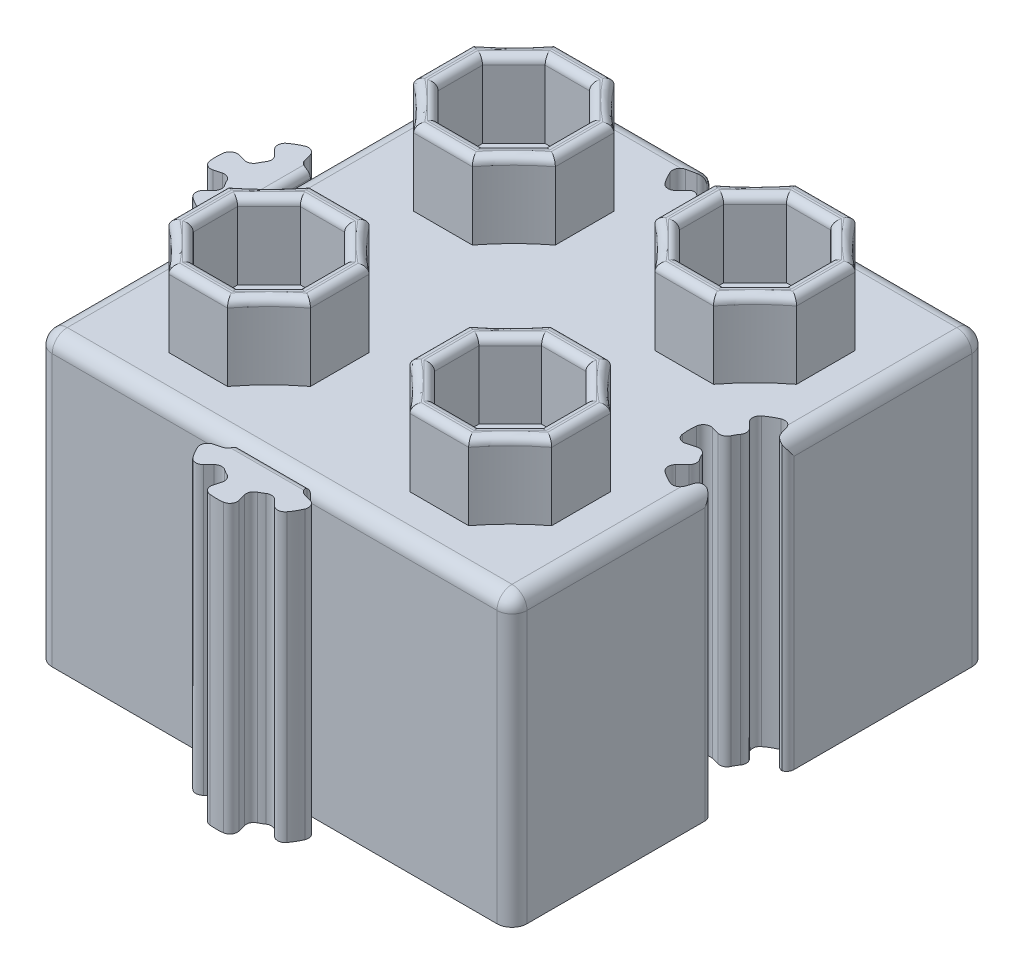
from build123d import *

# Parameters (mm, degrees)
SKETCH2_W                = 31.5
SKETCH2_H                = 31.5
BOSS_EXTRUDE1_DEPTH      = 19
CUT_EXTRUDE6_DEPTH       = 30.276697218
FILLET12_R               = 0.5
FILLET20_R               = 1
BOSS_EXTRUDE7_DEPTH      = 19
FILLET24_R               = 0.5
BOSS_EXTRUDE9_START      = -1
BOSS_EXTRUDE9_DEPTH      = 18
BOSS_EXTRUDE10_START     = -19
BOSS_EXTRUDE10_DEPTH     = 19
FILLET30_R               = 0.35
FILLET31_R               = 0.5
FILLET32_R               = 0.5
CUT_EXTRUDE13_DEPTH      = 2
CUT_EXTRUDE13_DEPTH_BACK = 1.5
BOSS_EXTRUDE11_DEPTH     = 5
FILLET33_R               = 0.5
CUT_EXTRUDE14_DEPTH      = 15
SKETCH18_W               = 1.2
SKETCH18_H               = 1.5
CUT_EXTRUDE15_DEPTH      = 0.025
CUT_EXTRUDE16_START      = -1.5
CUT_EXTRUDE16_DEPTH      = 1.5
FILLET34_R               = 0.5
FILLET35_START           = -1
FILLET35_DEPTH           = 16


with BuildPart() as part:
    # Sketch2 → Boss-Extrude1 (new body)
    with BuildSketch(Plane(origin=(0, 0, 0), x_dir=(1, 0, 0), z_dir=(0, 1, 0))):
        Rectangle(SKETCH2_W, SKETCH2_H)
    extrude(amount=BOSS_EXTRUDE1_DEPTH)

    # Sketch5 → Cut-Extrude6 (cut, through all)
    with BuildSketch(Plane(origin=(0, 19, 0), x_dir=(1, 0, 0), z_dir=(0, 1, 0))):
        with BuildLine():
            Line((-2.828427125, 12.921572875), (-1.767766953, 13.982233047))
            ThreePointArc((-1.767766953, 13.982233047), (-2.165063509, 14.5), (-2.414814566, 15.102952387))
            Line((-2.414814566, 15.102952387), (-3.863703305, 14.71472382))
            ThreePointArc((-3.863703305, 14.71472382), (-3.464101615, 13.75), (-2.828427125, 12.921572875))
        make_face()
        with BuildLine():
            Line((1.03527618, 11.886296695), (0.647047613, 13.335185434))
            ThreePointArc((0.647047613, 13.335185434), (0, 13.25), (-0.647047613, 13.335185434))
            Line((-0.647047613, 13.335185434), (-1.03527618, 11.886296695))
            ThreePointArc((-1.03527618, 11.886296695), (0, 11.75), (1.03527618, 11.886296695))
        make_face()
        with BuildLine():
            ThreePointArc((2.414814566, 15.102952387), (2.165063509, 14.5), (1.767766953, 13.982233047))
            Line((1.767766953, 13.982233047), (2.828427125, 12.921572875))
            ThreePointArc((2.828427125, 12.921572875), (3.464101615, 13.75), (3.863703305, 14.71472382))
            Line((3.863703305, 14.71472382), (2.414814566, 15.102952387))
        make_face()
        with BuildLine():
            ThreePointArc((-0.647047613, 13.335185434), (0, 13.25), (0.647047613, 13.335185434))
            ThreePointArc((0.647047613, 13.335185434), (1.25, 13.584936491), (1.767766953, 13.982233047))
            ThreePointArc((1.767766953, 13.982233047), (2.165063509, 14.5), (2.414814566, 15.102952387))
            ThreePointArc((2.414814566, 15.102952387), (2.478612153, 15.423684519), (2.5, 15.75))
            Line((2.5, 15.75), (0, 15.75))
            Line((0, 15.75), (-2.5, 15.75))
            ThreePointArc((-2.5, 15.75), (-2.478612153, 15.423684519), (-2.414814566, 15.102952387))
            ThreePointArc((-2.414814566, 15.102952387), (-2.165063509, 14.5), (-1.767766953, 13.982233047))
            ThreePointArc((-1.767766953, 13.982233047), (-1.25, 13.584936491), (-0.647047613, 13.335185434))
        make_face()
        with BuildLine():
            Line((15.75, -2.5), (15.75, 0))
            Line((15.75, 0), (15.75, 2.5))
            ThreePointArc((15.75, 2.5), (15.423684519, 2.478612153), (15.102952387, 2.414814566))
            ThreePointArc((15.102952387, 2.414814566), (14.5, 2.165063509), (13.982233047, 1.767766953))
            ThreePointArc((13.982233047, 1.767766953), (13.584936491, 1.25), (13.335185434, 0.647047613))
            ThreePointArc((13.335185434, 0.647047613), (13.25, 0), (13.335185434, -0.647047613))
            ThreePointArc((13.335185434, -0.647047613), (13.584936491, -1.25), (13.982233047, -1.767766953))
            ThreePointArc((13.982233047, -1.767766953), (14.5, -2.165063509), (15.102952387, -2.414814566))
            ThreePointArc((15.102952387, -2.414814566), (15.423684519, -2.478612153), (15.75, -2.5))
        make_face()
        with BuildLine():
            ThreePointArc((13.982233047, 1.767766953), (14.5, 2.165063509), (15.102952387, 2.414814566))
            Line((15.102952387, 2.414814566), (14.71472382, 3.863703305))
            ThreePointArc((14.71472382, 3.863703305), (13.75, 3.464101615), (12.921572875, 2.828427125))
            Line((12.921572875, 2.828427125), (13.982233047, 1.767766953))
        make_face()
        with BuildLine():
            Line((11.886296695, -1.03527618), (13.335185434, -0.647047613))
            ThreePointArc((13.335185434, -0.647047613), (13.25, 0), (13.335185434, 0.647047613))
            Line((13.335185434, 0.647047613), (11.886296695, 1.03527618))
            ThreePointArc((11.886296695, 1.03527618), (11.75, 0), (11.886296695, -1.03527618))
        make_face()
        with BuildLine():
            Line((14.71472382, -3.863703305), (15.102952387, -2.414814566))
            ThreePointArc((15.102952387, -2.414814566), (14.5, -2.165063509), (13.982233047, -1.767766953))
            Line((13.982233047, -1.767766953), (12.921572875, -2.828427125))
            ThreePointArc((12.921572875, -2.828427125), (13.75, -3.464101615), (14.71472382, -3.863703305))
        make_face()
    extrude(amount=-CUT_EXTRUDE6_DEPTH, mode=Mode.SUBTRACT)

    # Fillet12
    # the kernel refuses this fillet: 0.5 mm, written as the material it adds along each edge
    with BuildSketch(Plane(origin=(-2.828427125, 19, -12.921572875), x_dir=(0.7071067811865464, 0, -0.7071067811865488), z_dir=(0, -1, 0)), Plane(origin=(3.863703305, 19, -14.71472382), x_dir=(-0.9659258262890686, 0, -0.25881904510251896), z_dir=(0, -1, 0)), Plane(origin=(1.03527618, 19, -11.886296695), x_dir=(-0.25881904510252407, 0, -0.9659258262890674), z_dir=(0, -1, 0)), Plane(origin=(14.71472382, 19, 3.863703305), x_dir=(0.2588190451025213, 0, -0.9659258262890682), z_dir=(0, -1, 0)), Plane(origin=(11.886296695, 19, 1.03527618), x_dir=(0.9659258262890664, 0, -0.258819045102527), z_dir=(0, -1, 0)), Plane(origin=(12.921572875, 19, -2.828427125), x_dir=(0.7071067811865517, 0, 0.7071067811865434), z_dir=(0, -1, 0))) as fillet12_piece_1:
        with BuildLine():
            CenterArc((0.535898385, -0.5), FILLET12_R, 90, 98.213210702)
            ThreePointArc((0.041026726, -0.571428571), (0.010269865, -0.286449736), (0, 0))
            Line((0, 0), (0.535898385, 0))
        make_face()
    extrude(amount=19)
    with BuildSketch(Plane(origin=(-3.863703305, 19, -14.71472382), x_dir=(0.32732683535398166, 0, 0.9449111825230705), z_dir=(0, -1, 0)), Plane(origin=(2.828427125, 19, -12.921572875), x_dir=(0.6546536707079763, 0, -0.7559289460184553), z_dir=(0, -1, 0)), Plane(origin=(-1.03527618, 19, -11.886296695), x_dir=(0.9819805060619656, 0, 0.18898223650461393), z_dir=(0, -1, 0)), Plane(origin=(12.921572875, 19, 2.828427125), x_dir=(0.7559289460184622, 0, 0.6546536707079684), z_dir=(0, -1, 0)), Plane(origin=(11.886296695, 19, -1.03527618), x_dir=(-0.1889822365046017, 0, 0.9819805060619681), z_dir=(0, -1, 0)), Plane(origin=(14.71472382, 19, -3.863703305), x_dir=(-0.9449111825230665, 0, 0.327326835353993), z_dir=(0, -1, 0))) as fillet12_piece_2:
        with BuildLine():
            CenterArc((0.537093255, -0.498716267), FILLET12_R, 85.893394649, 98.213210702)
            Line((0.038376988, -0.534522484), (0, 0))
            ThreePointArc((0, 0), (0.286449736, 0.010269865), (0.572899472, 0))
        make_face()
    extrude(amount=19)
    # the kernel refuses this fillet: 0.5 mm, written as the material it takes off along each edge
    with BuildSketch(Plane(origin=(15.75, 20.145099729, -2.5), x_dir=(-0.996497189454961, 0, 0.08362626027967186), z_dir=(0, -1, 0)), Plane(origin=(15.102952387, 20.145099729, 2.414814566), x_dir=(0.9841864399500989, 0, 0.1771356864619615), z_dir=(0, -1, 0)), Plane(origin=(13.335185434, 20.145099729, 0.647047613), x_dir=(0.33868921558220527, 0, 0.9408983022879309), z_dir=(0, -1, 0)), Plane(origin=(13.982233047, 20.145099729, -1.767766953), x_dir=(-0.645497224367904, 0, 0.7637626158259723), z_dir=(0, -1, 0))) as fillet12_2_piece_1:
        with BuildLine():
            CenterArc((0.459944432, 0.498248595), FILLET12_R, 184.797034113, 80.405931773)
            Line((-0.038304163, 0.456435465), (0, 0))
            ThreePointArc((0, 0), (0.209065651, 0.008757026), (0.418131301, 0))
        make_face()
    extrude(amount=21.290199458, mode=Mode.SUBTRACT)
    with BuildSketch(Plane(origin=(15.75, 20.145099729, 2.5), x_dir=(0, 0, 1), z_dir=(0, -1, 0)), Plane(origin=(13.982233047, 20.145099729, 1.767766953), x_dir=(-0.7071067811865388, 0, 0.7071067811865562), z_dir=(0, -1, 0)), Plane(origin=(13.335185434, 20.145099729, -0.647047613), x_dir=(-0.9659258262890702, 0, -0.2588190451025135), z_dir=(0, -1, 0)), Plane(origin=(15.102952387, 20.145099729, -2.414814566), x_dir=(-0.25881904510252224, 0, -0.9659258262890679), z_dir=(0, -1, 0))) as fillet12_2_piece_2:
        with BuildLine():
            CenterArc((0.458039892, 0.5), FILLET12_R, 189.594068227, 80.405931773)
            ThreePointArc((-0.034966757, 0.416666667), (-0.008757026, 0.209065651), (0, 0))
            Line((0, 0), (0.458039892, 0))
        make_face()
    extrude(amount=21.290199458, mode=Mode.SUBTRACT)

    # Fillet20
    # the kernel refuses this fillet: 1 mm, written as the material it takes off along each edge
    with BuildSketch(Plane(origin=(14.75, 18, 14.75), x_dir=(0, 0, 1), z_dir=(1, 0, 0))) as fillet20_piece_1_section:
        Polygon((0, 0), (FILLET20_R * 1.02, 0), (FILLET20_R * 1.02, -FILLET20_R * 1.02), (0, -FILLET20_R * 1.02), align=None)
    fillet20_piece_1 = extrude(amount=FILLET20_R * 1.02, mode=Mode.PRIVATE)
    fillet20_piece_1 = fillet20_piece_1 - Plane(origin=(14.75, 18, 14.75), x_dir=(0, -0.7071067811865475, -0.7071067811865475), z_dir=(1, 0, 0)) * Sphere(FILLET20_R, mode=Mode.PRIVATE)
    add(fillet20_piece_1, mode=Mode.SUBTRACT)
    with BuildSketch(Plane(origin=(14.75, 18, -14.75), x_dir=(0, 0, -1), z_dir=(0, 1, 0))) as fillet20_piece_2_section:
        Polygon((0, 0), (FILLET20_R * 1.02, 0), (FILLET20_R * 1.02, -FILLET20_R * 1.02), (0, -FILLET20_R * 1.02), align=None)
    fillet20_piece_2 = extrude(amount=FILLET20_R * 1.02, mode=Mode.PRIVATE)
    fillet20_piece_2 = fillet20_piece_2 - Plane(origin=(14.75, 18, -14.75), x_dir=(-0.7071067811865475, 0, 0.7071067811865477), z_dir=(0, 1, 0)) * Sphere(FILLET20_R, mode=Mode.PRIVATE)
    add(fillet20_piece_2, mode=Mode.SUBTRACT)
    with BuildSketch(Plane(origin=(-14.75, 18, -14.75), x_dir=(-1, 0, 0), z_dir=(0, 1, 0))) as fillet20_piece_3_section:
        Polygon((0, 0), (FILLET20_R * 1.02, 0), (FILLET20_R * 1.02, -FILLET20_R * 1.02), (0, -FILLET20_R * 1.02), align=None)
    fillet20_piece_3 = extrude(amount=FILLET20_R * 1.02, mode=Mode.PRIVATE)
    fillet20_piece_3 = fillet20_piece_3 - Plane(origin=(-14.75, 18, -14.75), x_dir=(0.7071067811865476, 0, 0.7071067811865474), z_dir=(0, 1, 0)) * Sphere(FILLET20_R, mode=Mode.PRIVATE)
    add(fillet20_piece_3, mode=Mode.SUBTRACT)
    with BuildSketch(Plane(origin=(-14.75, 18, 14.75), x_dir=(-1, 0, 0), z_dir=(0, 0, 1))) as fillet20_piece_4_section:
        Polygon((0, 0), (FILLET20_R * 1.02, 0), (FILLET20_R * 1.02, -FILLET20_R * 1.02), (0, -FILLET20_R * 1.02), align=None)
    fillet20_piece_4 = extrude(amount=FILLET20_R * 1.02, mode=Mode.PRIVATE)
    fillet20_piece_4 = fillet20_piece_4 - Plane(origin=(-14.75, 18, 14.75), x_dir=(0.7071067811865475, -0.7071067811865475, 0), z_dir=(0, 0, 1)) * Sphere(FILLET20_R, mode=Mode.PRIVATE)
    add(fillet20_piece_4, mode=Mode.SUBTRACT)
    with BuildSketch(Plane(origin=(15.75, -2.5, 15.75), x_dir=(0, 0, -1), z_dir=(0, 1, 0)), Plane(origin=(15.75, -2.5, -15.75), x_dir=(-1, 0, 0), z_dir=(0, 1, 0)), Plane(origin=(-15.75, -2.5, -15.75), x_dir=(0, 0, 1), z_dir=(0, 1, 0)), Plane(origin=(-15.75, -2.5, 15.75), x_dir=(1, 0, 0), z_dir=(0, 1, 0))) as fillet20_piece_5:
        with BuildLine():
            CenterArc((FILLET20_R, FILLET20_R), FILLET20_R, 180, 90)
            Line((0, FILLET20_R), (0, 0))
            Line((0, 0), (FILLET20_R, 0))
        make_face()
    extrude(amount=20.5, mode=Mode.SUBTRACT)
    with BuildSketch(Plane(origin=(-14.75, 19, -15.75), x_dir=(0, 0, 1), z_dir=(1, 0, 0)), Plane(origin=(0, 19, -15.75), x_dir=(0, 0, 1), z_dir=(1, 0, 0))) as fillet20_piece_6:
        with BuildLine():
            CenterArc((FILLET20_R, FILLET20_R), FILLET20_R, 180, 90)
            Line((0, FILLET20_R), (0, 0))
            Line((0, 0), (FILLET20_R, 0))
        make_face()
    extrude(amount=14.75, mode=Mode.SUBTRACT)
    with BuildSketch(Plane(origin=(15.75, 19, -14.75), x_dir=(-1, 0, 0), z_dir=(0, 0, 1)), Plane(origin=(15.75, 19, 0.458039892), x_dir=(-1, 0, 0), z_dir=(0, 0, 1))) as fillet20_piece_7:
        with BuildLine():
            CenterArc((FILLET20_R, FILLET20_R), FILLET20_R, 180, 90)
            Line((0, FILLET20_R), (0, 0))
            Line((0, 0), (FILLET20_R, 0))
        make_face()
    extrude(amount=14.291960108, mode=Mode.SUBTRACT)
    with BuildSketch(Plane(origin=(14.75, 19, 15.75), x_dir=(0, 0, -1), z_dir=(-1, 0, 0)), Plane(origin=(-15.75, 19, 14.75), x_dir=(1, 0, 0), z_dir=(0, 0, -1))) as fillet20_piece_8:
        with BuildLine():
            CenterArc((FILLET20_R, FILLET20_R), FILLET20_R, 180, 90)
            Line((0, FILLET20_R), (0, 0))
            Line((0, 0), (FILLET20_R, 0))
        make_face()
    extrude(amount=29.5, mode=Mode.SUBTRACT)

    # Sketch6 → Boss-Extrude7 (add, through all)
    with BuildSketch(Plane(origin=(0, 19, 0), x_dir=(1, 0, 0), z_dir=(0, 1, 0))):
        with BuildLine():
            ThreePointArc((-2.375, -15.75), (-2.354681546, -16.059999707), (-2.294073837, -16.364695232))
            Line((-2.294073837, -16.364695232), (-3.742962577, -16.7529238))
            ThreePointArc((-3.742962577, -16.7529238), (-3.35584844, -17.6875), (-2.740038777, -18.490038777))
            Line((-2.740038777, -18.490038777), (-1.679378605, -17.429378605))
            ThreePointArc((-1.679378605, -17.429378605), (-1.189926656, -17.805407393), (-0.620108527, -18.0426165))
            Line((-0.620108527, -18.0426165), (-1.011756018, -19.490584815))
            ThreePointArc((-1.011756018, -19.490584815), (0, -19.625), (1.011756018, -19.490584815))
            Line((1.011756018, -19.490584815), (0.620108527, -18.0426165))
            ThreePointArc((0.620108527, -18.0426165), (1.189926656, -17.805407393), (1.679378605, -17.429378605))
            Line((1.679378605, -17.429378605), (2.740038777, -18.490038777))
            ThreePointArc((2.740038777, -18.490038777), (3.35584844, -17.6875), (3.742962577, -16.7529238))
            Line((3.742962577, -16.7529238), (2.294073837, -16.364695232))
            ThreePointArc((2.294073837, -16.364695232), (2.354681546, -16.059999707), (2.375, -15.75))
            Line((2.375, -15.75), (-2.375, -15.75))
        make_face()
        with BuildLine():
            Line((-15.75, -2.375), (-15.75, 2.375))
            ThreePointArc((-15.75, 2.375), (-16.059999707, 2.354681546), (-16.364695232, 2.294073837))
            Line((-16.364695232, 2.294073837), (-16.7529238, 3.742962577))
            ThreePointArc((-16.7529238, 3.742962577), (-17.6875, 3.35584844), (-18.490038777, 2.740038777))
            Line((-18.490038777, 2.740038777), (-17.429378605, 1.679378605))
            ThreePointArc((-17.429378605, 1.679378605), (-17.806810334, 1.1875), (-18.044073837, 0.614695232))
            Line((-18.044073837, 0.614695232), (-19.492962577, 1.0029238))
            ThreePointArc((-19.492962577, 1.0029238), (-19.625, 0), (-19.492962577, -1.0029238))
            Line((-19.492962577, -1.0029238), (-18.044073837, -0.614695232))
            ThreePointArc((-18.044073837, -0.614695232), (-17.806810334, -1.1875), (-17.429378605, -1.679378605))
            Line((-17.429378605, -1.679378605), (-18.490038777, -2.740038777))
            ThreePointArc((-18.490038777, -2.740038777), (-17.6875, -3.35584844), (-16.7529238, -3.742962577))
            Line((-16.7529238, -3.742962577), (-16.364695232, -2.294073837))
            ThreePointArc((-16.364695232, -2.294073837), (-16.059999707, -2.354681546), (-15.75, -2.375))
        make_face()
    extrude(amount=-BOSS_EXTRUDE7_DEPTH)

    # Fillet24
    fillet24_edges = [part.edges().sort_by_distance(p)[0] for p in [
        (-16.364695232, 9.5, 2.294073837),
        (-16.7529238, 9.5, 3.742962577),
        (-18.490038777, 9.5, 2.740038777),
        (-17.429378605, 9.5, 1.679378605),
        (-18.044073837, 9.5, 0.614695232),
        (-19.492962577, 9.5, 1.0029238),
        (-19.492962577, 9.5, -1.0029238),
        (-18.044073837, 9.5, -0.614695232),
        (-17.429378605, 9.5, -1.679378605),
        (-18.490038777, 9.5, -2.740038777),
        (-16.7529238, 9.5, -3.742962577),
        (-16.364695232, 9.5, -2.294073837),
        (0.620108527, 9.5, 18.0426165),
        (1.011756018, 9.5, 19.490584815),
        (-1.011756018, 9.5, 19.490584815),
        (-0.620108527, 9.5, 18.0426165),
        (-1.679378605, 9.5, 17.429378605),
        (-2.740038777, 9.5, 18.490038777),
        (-3.742962577, 9.5, 16.7529238),
        (-2.294073837, 9.5, 16.364695232),
        (2.294073837, 9.5, 16.364695232),
        (3.742962577, 9.5, 16.7529238),
        (2.740038777, 9.5, 18.490038777),
        (1.679378605, 9.5, 17.429378605),
    ]]
    fillet(fillet24_edges, radius=FILLET24_R)

    # Sketch10 → Boss-Extrude9 (add, through all)
    with BuildSketch(Plane(origin=(0, 19, 0), x_dir=(1, 0, 0), z_dir=(0, 1, 0)).offset(BOSS_EXTRUDE9_START)):
        with BuildLine():
            Line((15.75, 4.4), (15.75, 4))
            ThreePointArc((15.75, 4), (11.75, 0), (15.75, -4))
            Line((15.75, -4), (15.75, -4.4))
            ThreePointArc((15.75, -4.4), (11.35, 0), (15.75, 4.4))
        make_face()
        with BuildLine():
            Line((-4.4, 15.75), (-4, 15.75))
            ThreePointArc((-4, 15.75), (0, 11.75), (4, 15.75))
            Line((4, 15.75), (4.4, 15.75))
            ThreePointArc((4.4, 15.75), (0, 11.35), (-4.4, 15.75))
        make_face()
    extrude(amount=-BOSS_EXTRUDE9_DEPTH)

    # Boss-Extrude10: read off the stored shape, not the designer's step
    # Boss-Extrude10 outline → Boss-Extrude10 (add)
    with BuildSketch(Plane(origin=(0, 19, 0), x_dir=(1, 0, 0), z_dir=(0, 1, 0)).offset(BOSS_EXTRUDE10_START)):
        with BuildLine():
            Line((13.658349934, -2.091650066), (14.070621395, -1.679378605))
            ThreePointArc((14.070621395, -1.679378605), (13.693189666, -1.1875), (13.455926163, -0.614695232))
            Line((13.455926163, -0.614695232), (12.892752874, -0.76559706))
            ThreePointArc((12.892752874, -0.76559706), (13.235075461, -0.796157468), (13.476801997, -1.040466644))
            ThreePointArc((13.476801997, -1.040466644), (13.584936491, -1.25), (13.712330453, -1.448413896))
            ThreePointArc((13.712330453, -1.448413896), (13.803045138, -1.779909805), (13.658349934, -2.091650066))
        make_face()
    extrude(amount=BOSS_EXTRUDE10_DEPTH)

    # Fillet30
    fillet30_edges = [part.edges().sort_by_distance(p)[0] for p in [
        (2.493564071, 18.571318411, -15.570728498),
        (-2.493564071, 18.571318411, -15.570728498),
        (2.5, 9, -15.75),
        (2.414814566, 9.467820642, -15.102952387),
        (-2.414814566, 9.467820642, -15.102952387),
        (-2.5, 9, -15.75),
        (-1.767766953, 9.5, -13.982233047),
        (-0.647047613, 9.5, -13.335185434),
        (0.647047613, 9.5, -13.335185434),
    ]]
    fillet(fillet30_edges, radius=FILLET30_R)

    # Fillet31
    fillet31_edges = [part.edges().sort_by_distance(p)[0] for p in [
        (0, 19, 15.75),
        (-15.75, 19, 0),
    ]]
    fillet(fillet31_edges, radius=FILLET31_R)

    # Fillet32
    fillet32_edges = [part.edges().sort_by_distance(p)[0] for p in [
        (13.455926163, 9.5, 0.614695232),
        (14.070621395, 9.5, 1.679378605),
    ]]
    fillet(fillet32_edges, radius=FILLET32_R)

    # Sketch16 → Cut-Extrude13 (cut, two sides: drawn at the far end of the back side and taken through both)
    with BuildSketch(Plane.XZ.offset(-CUT_EXTRUDE13_DEPTH_BACK)):
        with BuildLine():
            Line((-14.3, 14.3), (-8.175, 14.3))
            Line((-8.175, 14.3), (-8.175, 12.6))
            ThreePointArc((-8.175, 12.6), (-8.145710678, 12.529289322), (-8.075, 12.5))
            Line((-8.075, 12.5), (-6.825, 12.5))
            ThreePointArc((-6.825, 12.5), (-6.754289322, 12.529289322), (-6.725, 12.6))
            Line((-6.725, 12.6), (-6.725, 14.3))
            Line((-6.725, 14.3), (6.721665956, 14.3))
            Line((6.721665956, 14.3), (6.721665956, 12.6))
            ThreePointArc((6.721665956, 12.6), (6.750955278, 12.529289322), (6.821665956, 12.5))
            Line((6.821665956, 12.5), (8.071665956, 12.5))
            ThreePointArc((8.071665956, 12.5), (8.142376634, 12.529289322), (8.171665956, 12.6))
            Line((8.171665956, 12.6), (8.171665956, 14.3))
            Line((8.171665956, 14.3), (14.3, 14.3))
            Line((14.3, 14.3), (14.3, 8.175))
            Line((14.3, 8.175), (12.6, 8.175))
            ThreePointArc((12.6, 8.175), (12.529289322, 8.145710678), (12.5, 8.075))
            Line((12.5, 8.075), (12.5, 6.825))
            ThreePointArc((12.5, 6.825), (12.529289322, 6.754289322), (12.6, 6.725))
            Line((12.6, 6.725), (14.3, 6.725))
            Line((14.3, 6.725), (14.3, 4.623310502))
            ThreePointArc((14.3, 4.623310502), (11.956404012, 3.135991924), (10.82799643, 0.6))
            ThreePointArc((10.82799643, 0.6), (10.782740417, 0), (10.82799643, -0.6))
            ThreePointArc((10.82799643, -0.6), (11.956404012, -3.135991924), (14.3, -4.623310502))
            Line((14.3, -4.623310502), (14.3, -6.725))
            Line((14.3, -6.725), (12.6, -6.725))
            ThreePointArc((12.6, -6.725), (12.529289322, -6.754289322), (12.5, -6.825))
            Line((12.5, -6.825), (12.5, -8.075))
            ThreePointArc((12.5, -8.075), (12.529289322, -8.145710678), (12.6, -8.175))
            Line((12.6, -8.175), (14.3, -8.175))
            Line((14.3, -8.175), (14.3, -14.3))
            Line((14.3, -14.3), (8.35038088, -14.3))
            Line((8.35038088, -14.3), (8.171665956, -14.3))
            Line((8.171665956, -14.3), (8.171665956, -12.6))
            ThreePointArc((8.171665956, -12.6), (8.142376634, -12.529289322), (8.071665956, -12.5))
            Line((8.071665956, -12.5), (6.821665956, -12.5))
            ThreePointArc((6.821665956, -12.5), (6.750955278, -12.529289322), (6.721665956, -12.6))
            Line((6.721665956, -12.6), (6.721665956, -14.3))
            Line((6.721665956, -14.3), (4.623310502, -14.3))
            Line((4.623310502, -14.3), (4.575751304, -14.3))
            ThreePointArc((4.575751304, -14.3), (3.072656017, -12.062346952), (0.600502286, -10.987710949))
            ThreePointArc((0.600502286, -10.987710949), (-0.001645996, -10.942336934), (-0.603763067, -10.988123252))
            ThreePointArc((-0.603763067, -10.988123252), (-3.073918375, -12.063399151), (-4.575751304, -14.3))
            Line((-4.575751304, -14.3), (-4.623310502, -14.3))
            Line((-4.623310502, -14.3), (-6.725, -14.3))
            Line((-6.725, -14.3), (-6.725, -12.6))
            ThreePointArc((-6.725, -12.6), (-6.754289322, -12.529289322), (-6.825, -12.5))
            Line((-6.825, -12.5), (-8.075, -12.5))
            ThreePointArc((-8.075, -12.5), (-8.145710678, -12.529289322), (-8.175, -12.6))
            Line((-8.175, -12.6), (-8.175, -14.3))
            Line((-8.175, -14.3), (-14.3, -14.3))
            Line((-14.3, -14.3), (-14.3, -8.175))
            Line((-14.3, -8.175), (-12.6, -8.175))
            ThreePointArc((-12.6, -8.175), (-12.529289322, -8.145710678), (-12.5, -8.075))
            Line((-12.5, -8.075), (-12.5, -6.825))
            ThreePointArc((-12.5, -6.825), (-12.529289322, -6.754289322), (-12.6, -6.725))
            Line((-12.6, -6.725), (-14.3, -6.725))
            Line((-14.3, -6.725), (-14.3, 6.725))
            Line((-14.3, 6.725), (-12.6, 6.725))
            ThreePointArc((-12.6, 6.725), (-12.529289322, 6.754289322), (-12.5, 6.825))
            Line((-12.5, 6.825), (-12.5, 8.075))
            ThreePointArc((-12.5, 8.075), (-12.529289322, 8.145710678), (-12.6, 8.175))
            Line((-12.6, 8.175), (-14.3, 8.175))
            Line((-14.3, 8.175), (-14.3, 14.3))
        make_face()
    extrude(amount=CUT_EXTRUDE13_DEPTH + CUT_EXTRUDE13_DEPTH_BACK, mode=Mode.SUBTRACT)

    # Sketch3 → Boss-Extrude11 (add)
    # profile 1 of 4: a face of its own
    with BuildSketch(Plane(origin=(0, 19, 0), x_dir=(1, 0, 0), z_dir=(0, 1, 0))):
        with BuildLine():
            ThreePointArc((-9.946803743, 3.421093296), (-11.233690264, 4.887403031), (-12.7, 6.174289552))
            Line((-12.7, 6.174289552), (-12.7, 10.067897039))
            ThreePointArc((-12.7, 10.067897039), (-11.233690264, 11.35478356), (-9.946803743, 12.821093296))
            Line((-9.946803743, 12.821093296), (-6.053196257, 12.821093296))
            ThreePointArc((-6.053196257, 12.821093296), (-4.766309736, 11.35478356), (-3.3, 10.067897039))
            Line((-3.3, 10.067897039), (-3.3, 6.174289552))
            ThreePointArc((-3.3, 6.174289552), (-4.766309736, 4.887403031), (-6.053196257, 3.421093296))
            Line((-6.053196257, 3.421093296), (-9.946803743, 3.421093296))
        make_face()
        Polygon((-9.470458146, 4.571093296), (-6.529541854, 4.571093296), (-4.45, 6.650635149), (-4.45, 9.591551442), (-6.529541854, 11.671093296), (-9.470458146, 11.671093296), (-11.55, 9.591551442), (-11.55, 6.650635149), align=None, mode=Mode.SUBTRACT)
    # profile 2 of 4: a face of its own
    with BuildSketch(Plane(origin=(0, 19, 0), x_dir=(1, 0, 0), z_dir=(0, 1, 0))):
        with BuildLine():
            Line((12.7, 10.067897039), (12.7, 6.174289552))
            ThreePointArc((12.7, 6.174289552), (11.233690264, 4.887403031), (9.946803743, 3.421093296))
            Line((9.946803743, 3.421093296), (6.053196257, 3.421093296))
            ThreePointArc((6.053196257, 3.421093296), (4.766309736, 4.887403031), (3.3, 6.174289552))
            Line((3.3, 6.174289552), (3.3, 10.067897039))
            ThreePointArc((3.3, 10.067897039), (4.766309736, 11.35478356), (6.053196257, 12.821093296))
            Line((6.053196257, 12.821093296), (9.946803743, 12.821093296))
            ThreePointArc((9.946803743, 12.821093296), (11.233690264, 11.35478356), (12.7, 10.067897039))
        make_face()
        Polygon((9.470458146, 4.571093296), (6.529541854, 4.571093296), (4.45, 6.650635149), (4.45, 9.591551442), (6.529541854, 11.671093296), (9.470458146, 11.671093296), (11.55, 9.591551442), (11.55, 6.650635149), align=None, mode=Mode.SUBTRACT)
    # profile 3 of 4: a face of its own
    with BuildSketch(Plane(origin=(0, 19, 0), x_dir=(1, 0, 0), z_dir=(0, 1, 0))):
        with BuildLine():
            ThreePointArc((9.946803743, -3.421093296), (11.233690264, -4.887403031), (12.7, -6.174289552))
            Line((12.7, -6.174289552), (12.7, -10.067897039))
            ThreePointArc((12.7, -10.067897039), (11.233690264, -11.35478356), (9.946803743, -12.821093296))
            Line((9.946803743, -12.821093296), (6.053196257, -12.821093296))
            ThreePointArc((6.053196257, -12.821093296), (4.766309736, -11.35478356), (3.3, -10.067897039))
            Line((3.3, -10.067897039), (3.3, -6.174289552))
            ThreePointArc((3.3, -6.174289552), (4.766309736, -4.887403031), (6.053196257, -3.421093296))
            Line((6.053196257, -3.421093296), (9.946803743, -3.421093296))
        make_face()
        Polygon((9.470458146, -4.571093296), (6.529541854, -4.571093296), (4.45, -6.650635149), (4.45, -9.591551442), (6.529541854, -11.671093296), (9.470458146, -11.671093296), (11.55, -9.591551442), (11.55, -6.650635149), align=None, mode=Mode.SUBTRACT)
    # profile 4 of 4: a face of its own
    with BuildSketch(Plane(origin=(0, 19, 0), x_dir=(1, 0, 0), z_dir=(0, 1, 0))):
        with BuildLine():
            Line((-12.7, -10.067897039), (-12.7, -6.174289552))
            ThreePointArc((-12.7, -6.174289552), (-11.233690264, -4.887403031), (-9.946803743, -3.421093296))
            Line((-9.946803743, -3.421093296), (-6.053196257, -3.421093296))
            ThreePointArc((-6.053196257, -3.421093296), (-4.766309736, -4.887403031), (-3.3, -6.174289552))
            Line((-3.3, -6.174289552), (-3.3, -10.067897039))
            ThreePointArc((-3.3, -10.067897039), (-4.766309736, -11.35478356), (-6.053196257, -12.821093296))
            Line((-6.053196257, -12.821093296), (-9.946803743, -12.821093296))
            ThreePointArc((-9.946803743, -12.821093296), (-11.233690264, -11.35478356), (-12.7, -10.067897039))
        make_face()
        Polygon((-9.470458146, -4.571093296), (-6.529541854, -4.571093296), (-4.45, -6.650635149), (-4.45, -9.591551442), (-6.529541854, -11.671093296), (-9.470458146, -11.671093296), (-11.55, -9.591551442), (-11.55, -6.650635149), align=None, mode=Mode.SUBTRACT)
    extrude(amount=BOSS_EXTRUDE11_DEPTH)

    # Fillet33
    fillet33_edges = [part.edges().sort_by_distance(p)[0] for p in [
        (-8, 24, -4.571093296),
        (-10.510229073, 24, -5.610864222),
        (-11.55, 24, -8.121093296),
        (-10.510229073, 24, -10.631322369),
        (-8, 24, -11.671093296),
        (-5.489770927, 24, -10.631322369),
        (-4.45, 24, -8.121093296),
        (-11.233690264, 24, -4.887403031),
        (-4.766309736, 24, -11.35478356),
        (-11.233690264, 24, -11.35478356),
        (-5.489770927, 24, -5.610864222),
        (-8, 24, -3.421093296),
        (-4.766309736, 24, -4.887403031),
        (-3.3, 24, -8.121093296),
        (-8, 24, -12.821093296),
        (-12.7, 24, -8.121093296),
        (12.7, 24, -8.121093296),
        (8, 24, -12.821093296),
        (3.3, 24, -8.121093296),
        (4.766309736, 24, -4.887403031),
        (8, 24, -3.421093296),
        (8, 24, -4.571093296),
        (5.489770927, 24, -5.610864222),
        (4.45, 24, -8.121093296),
        (5.489770927, 24, -10.631322369),
        (8, 24, -11.671093296),
        (10.510229073, 24, -10.631322369),
        (11.55, 24, -8.121093296),
        (10.510229073, 24, -5.610864222),
        (11.233690264, 24, -11.35478356),
        (4.766309736, 24, -11.35478356),
        (11.233690264, 24, -4.887403031),
        (8, 24, 4.571093296),
        (10.510229073, 24, 5.610864222),
        (11.55, 24, 8.121093296),
        (10.510229073, 24, 10.631322369),
        (8, 24, 11.671093296),
        (5.489770927, 24, 10.631322369),
        (4.45, 24, 8.121093296),
        (11.233690264, 24, 4.887403031),
        (4.766309736, 24, 11.35478356),
        (11.233690264, 24, 11.35478356),
        (5.489770927, 24, 5.610864222),
        (8, 24, 3.421093296),
        (4.766309736, 24, 4.887403031),
        (3.3, 24, 8.121093296),
        (8, 24, 12.821093296),
        (12.7, 24, 8.121093296),
        (-12.7, 24, 8.121093296),
        (-8, 24, 12.821093296),
        (-3.3, 24, 8.121093296),
        (-4.766309736, 24, 4.887403031),
        (-8, 24, 3.421093296),
        (-8, 24, 4.571093296),
        (-5.489770927, 24, 5.610864222),
        (-4.45, 24, 8.121093296),
        (-5.489770927, 24, 10.631322369),
        (-8, 24, 11.671093296),
        (-10.510229073, 24, 10.631322369),
        (-11.55, 24, 8.121093296),
        (-10.510229073, 24, 5.610864222),
        (-11.233690264, 24, 11.35478356),
        (-4.766309736, 24, 11.35478356),
        (-11.233690264, 24, 4.887403031),
    ]]
    fillet(fillet33_edges, radius=FILLET33_R)

    # Sketch7 → Cut-Extrude14 (cut)
    with BuildSketch(Plane.XZ):
        with BuildLine():
            ThreePointArc((-4.259988263, -14.3), (-2.859722023, -12.275523068), (-0.603763067, -11.290687255))
            Line((-0.603763067, -11.290687255), (-0.603763067, -4.963413156))
            ThreePointArc((-0.603763067, -4.963413156), (-1.845028292, -4.647135742), (-2.965202778, -4.025862949))
            Line((-2.965202778, -4.025862949), (-3.959797975, -5.020458146))
            Line((-3.959797975, -5.020458146), (-5.020458146, -3.959797975))
            Line((-5.020458146, -3.959797975), (-4.027923069, -2.962403712))
            ThreePointArc((-4.027923069, -2.962403712), (-4.64847513, -1.841651151), (-4.963869458, -0.6))
            Line((-4.963869458, -0.6), (-14.325, -0.6))
            Line((-14.325, -0.6), (-14.325, -6.725))
            Line((-14.325, -6.725), (-12.675, -6.725))
            Line((-12.675, -6.725), (-12.675, -7.3))
            Line((-12.675, -7.3), (-14.325, -7.3))
            Line((-14.325, -7.3), (-14.325, -14.3))
            Line((-14.325, -14.3), (-7.325, -14.3))
            Line((-7.325, -14.3), (-7.325, -12.65))
            Line((-7.325, -12.65), (-6.725, -12.65))
            Line((-6.725, -12.65), (-6.725, -14.3))
            Line((-6.725, -14.3), (-4.259988263, -14.3))
        make_face()
        with BuildLine():
            ThreePointArc((14.3, -4.259988263), (12.274316834, -2.858255854), (11.290179376, -0.6))
            Line((11.290179376, -0.6), (4.963869458, -0.6))
            ThreePointArc((4.963869458, -0.6), (4.64847513, -1.841651151), (4.027923069, -2.962403712))
            Line((4.027923069, -2.962403712), (5.020458146, -3.959797975))
            Line((5.020458146, -3.959797975), (3.959797975, -5.020458146))
            Line((3.959797975, -5.020458146), (2.965202778, -4.025862949))
            ThreePointArc((2.965202778, -4.025862949), (1.843266601, -4.64783479), (0.6, -4.963869458))
            Line((0.6, -4.963869458), (0.6, -11.290179376))
            ThreePointArc((0.6, -11.290179376), (2.86843208, -12.282710367), (4.268415983, -14.325))
            Line((4.268415983, -14.325), (6.7, -14.325))
            Line((6.7, -14.325), (6.7, -12.525))
            Line((6.7, -12.525), (7.3, -12.525))
            Line((7.3, -12.525), (7.3, -14.325))
            Line((7.3, -14.325), (14.3, -14.325))
            Line((14.3, -14.325), (14.3, -7.325))
            Line((14.3, -7.325), (12.65, -7.325))
            Line((12.65, -7.325), (12.65, -6.725))
            Line((12.65, -6.725), (14.3, -6.725))
            Line((14.3, -6.725), (14.3, -4.259988263))
        make_face()
        with BuildLine():
            Line((7.571665956, 14.3), (0.6, 14.3))
            Line((0.6, 14.3), (0.6, 4.963869458))
            ThreePointArc((0.6, 4.963869458), (1.843266601, 4.64783479), (2.965202778, 4.025862949))
            Line((2.965202778, 4.025862949), (3.959797975, 5.020458146))
            Line((3.959797975, 5.020458146), (5.020458146, 3.959797975))
            Line((5.020458146, 3.959797975), (4.027923069, 2.962403712))
            ThreePointArc((4.027923069, 2.962403712), (4.64847513, 1.841651151), (4.963869458, 0.6))
            Line((4.963869458, 0.6), (11.290179376, 0.6))
            ThreePointArc((11.290179376, 0.6), (12.274316834, 2.858255854), (14.3, 4.259988263))
            Line((14.3, 4.259988263), (14.3, 6.7))
            Line((14.3, 6.7), (12.5, 6.7))
            Line((12.5, 6.7), (12.5, 7.3))
            Line((12.5, 7.3), (14.3, 7.3))
            Line((14.3, 7.3), (14.3, 14.3))
            Line((14.3, 14.3), (8.171665956, 14.3))
            Line((8.171665956, 14.3), (8.171665956, 12.65))
            Line((8.171665956, 12.65), (7.571665956, 12.65))
            Line((7.571665956, 12.65), (7.571665956, 14.3))
        make_face()
        with BuildLine():
            Line((-7.325, 14.3), (-14.325, 14.3))
            Line((-14.325, 14.3), (-14.325, 7.3))
            Line((-14.325, 7.3), (-12.525, 7.3))
            Line((-12.525, 7.3), (-12.525, 6.7))
            Line((-12.525, 6.7), (-14.325, 6.7))
            Line((-14.325, 6.7), (-14.325, 0.6))
            Line((-14.325, 0.6), (-4.963869458, 0.6))
            ThreePointArc((-4.963869458, 0.6), (-4.64847513, 1.841651151), (-4.027923069, 2.962403712))
            Line((-4.027923069, 2.962403712), (-5.020458146, 3.959797975))
            Line((-5.020458146, 3.959797975), (-3.959797975, 5.020458146))
            Line((-3.959797975, 5.020458146), (-2.965202778, 4.025862949))
            ThreePointArc((-2.965202778, 4.025862949), (-1.845028292, 4.647135742), (-0.603763067, 4.963413156))
            Line((-0.603763067, 4.963413156), (-0.603763067, 14.3))
            Line((-0.603763067, 14.3), (-6.725, 14.3))
            Line((-6.725, 14.3), (-6.725, 12.65))
            Line((-6.725, 12.65), (-7.325, 12.65))
            Line((-7.325, 12.65), (-7.325, 14.3))
        make_face()
        with BuildLine():
            ThreePointArc((2.828427125, 2.828427125), (2, 3.464101615), (1.03527618, 3.863703305))
            Line((1.03527618, 3.863703305), (0.647047613, 2.414814566))
            ThreePointArc((0.647047613, 2.414814566), (0, 2.5), (-0.647047613, 2.414814566))
            Line((-0.647047613, 2.414814566), (-1.03527618, 3.863703305))
            ThreePointArc((-1.03527618, 3.863703305), (-2, 3.464101615), (-2.828427125, 2.828427125))
            Line((-2.828427125, 2.828427125), (-1.767766953, 1.767766953))
            ThreePointArc((-1.767766953, 1.767766953), (-2.165063509, 1.25), (-2.414814566, 0.647047613))
            Line((-2.414814566, 0.647047613), (-3.863703305, 1.03527618))
            ThreePointArc((-3.863703305, 1.03527618), (-4, 0), (-3.863703305, -1.03527618))
            Line((-3.863703305, -1.03527618), (-2.414814566, -0.647047613))
            ThreePointArc((-2.414814566, -0.647047613), (-2.165063509, -1.25), (-1.767766953, -1.767766953))
            Line((-1.767766953, -1.767766953), (-2.828427125, -2.828427125))
            ThreePointArc((-2.828427125, -2.828427125), (-2, -3.464101615), (-1.03527618, -3.863703305))
            Line((-1.03527618, -3.863703305), (-0.647047613, -2.414814566))
            ThreePointArc((-0.647047613, -2.414814566), (0, -2.5), (0.647047613, -2.414814566))
            Line((0.647047613, -2.414814566), (1.03527618, -3.863703305))
            ThreePointArc((1.03527618, -3.863703305), (2, -3.464101615), (2.828427125, -2.828427125))
            Line((2.828427125, -2.828427125), (1.767766953, -1.767766953))
            ThreePointArc((1.767766953, -1.767766953), (2.165063509, -1.25), (2.414814566, -0.647047613))
            Line((2.414814566, -0.647047613), (3.863703305, -1.03527618))
            ThreePointArc((3.863703305, -1.03527618), (4, 0), (3.863703305, 1.03527618))
            Line((3.863703305, 1.03527618), (2.414814566, 0.647047613))
            ThreePointArc((2.414814566, 0.647047613), (2.165063509, 1.25), (1.767766953, 1.767766953))
            Line((1.767766953, 1.767766953), (2.828427125, 2.828427125))
        make_face()
    extrude(amount=-CUT_EXTRUDE14_DEPTH, mode=Mode.SUBTRACT)

    # Sketch18 → Cut-Extrude15 (cut)
    with BuildSketch(Plane(origin=(-14.3, 0, 0), x_dir=(0, 0, -1), z_dir=(1, 0, 0))):
        with Locations((0, 0.75)):
            Rectangle(SKETCH18_W, SKETCH18_H)
    extrude(amount=-CUT_EXTRUDE15_DEPTH, mode=Mode.SUBTRACT)

    # Sketch19 → Cut-Extrude16 (cut)
    with BuildSketch(Plane.XZ.offset(CUT_EXTRUDE16_START)):
        with BuildLine():
            Line((-0.603763067, -11.290687255), (-0.603763067, -10.988123252))
            ThreePointArc((-0.603763067, -10.988123252), (-0.001900018, -10.942337029), (0.6, -10.987634675))
            Line((0.6, -10.987634675), (0.6, -11.290179376))
            ThreePointArc((0.6, -11.290179376), (-0.001900748, -11.24489138), (-0.603763067, -11.290687255))
        make_face()
        with BuildLine():
            Line((11.290179376, 0.6), (10.82799643, 0.6))
            ThreePointArc((10.82799643, 0.6), (10.782740417, 0), (10.82799643, -0.6))
            Line((10.82799643, -0.6), (11.290179376, -0.6))
            ThreePointArc((11.290179376, -0.6), (11.244923362, 0), (11.290179376, 0.6))
        make_face()
    extrude(amount=CUT_EXTRUDE16_DEPTH, mode=Mode.SUBTRACT)

    # Fillet34
    fillet34_edges = [part.edges().sort_by_distance(p)[0] for p in [
        (-1.767766953, 8.25, 1.767766953),
        (-2.828427125, 8.25, 2.828427125),
        (-1.03527618, 8.25, 3.863703305),
        (-0.647047613, 8.25, 2.414814566),
        (0.647047613, 8.25, 2.414814566),
        (1.03527618, 8.25, 3.863703305),
        (2.828427125, 8.25, 2.828427125),
        (1.767766953, 8.25, 1.767766953),
        (2.414814566, 8.25, 0.647047613),
        (3.863703305, 8.25, 1.03527618),
        (3.863703305, 8.25, -1.03527618),
        (2.414814566, 8.25, -0.647047613),
        (1.767766953, 8.25, -1.767766953),
        (2.828427125, 8.25, -2.828427125),
        (1.03527618, 8.25, -3.863703305),
        (0.647047613, 8.25, -2.414814566),
        (-0.647047613, 8.25, -2.414814566),
        (-1.03527618, 8.25, -3.863703305),
        (-2.828427125, 8.25, -2.828427125),
        (-1.767766953, 8.25, -1.767766953),
        (-2.414814566, 8.25, -0.647047613),
        (-3.863703305, 8.25, -1.03527618),
        (-3.863703305, 8.25, 1.03527618),
        (-2.414814566, 8.25, 0.647047613),
    ]]
    fillet(fillet34_edges, radius=FILLET34_R)

    # Fillet35: read off the stored shape, not the designer's step
    # Fillet35 outline → Fillet35 (cut)
    with BuildSketch(Plane(origin=(0, 0, 0), x_dir=(1, 0, 0), z_dir=(0, 1, 0)).offset(FILLET35_START)):
        with BuildLine():
            Line((-5.020458146, -3.959797975), (-4.879381704, -4.100874417))
            ThreePointArc((-4.879381704, -4.100874417), (-4.937960198, -3.959697249), (-4.879726616, -3.818377461))
            Line((-4.879726616, -3.818377461), (-5.020458146, -3.959797975))
        make_face()
        with BuildLine():
            ThreePointArc((-3.818376618, -4.87903679), (-3.959797974, -4.937615434), (-4.101219331, -4.87903679))
            Line((-4.101219331, -4.87903679), (-3.959797975, -5.020458146))
            Line((-3.959797975, -5.020458146), (-3.818376618, -4.87903679))
        make_face()
        with BuildLine():
            Line((3.959797975, -5.020458146), (4.101219331, -4.87903679))
            ThreePointArc((4.101219331, -4.87903679), (3.959797974, -4.937615434), (3.818376618, -4.87903679))
            Line((3.818376618, -4.87903679), (3.959797975, -5.020458146))
        make_face()
        with BuildLine():
            ThreePointArc((4.879726616, -3.818377461), (4.937960198, -3.959697249), (4.879381704, -4.100874417))
            Line((4.879381704, -4.100874417), (5.020458146, -3.959797975))
            Line((5.020458146, -3.959797975), (4.879726616, -3.818377461))
        make_face()
        with BuildLine():
            Line((5.020458146, 3.959797975), (4.879381704, 4.100874417))
            ThreePointArc((4.879381704, 4.100874417), (4.937960198, 3.959697249), (4.879726616, 3.818377461))
            Line((4.879726616, 3.818377461), (5.020458146, 3.959797975))
        make_face()
        with BuildLine():
            ThreePointArc((3.818376618, 4.87903679), (3.959797974, 4.937615434), (4.101219331, 4.87903679))
            Line((4.101219331, 4.87903679), (3.959797975, 5.020458146))
            Line((3.959797975, 5.020458146), (3.818376618, 4.87903679))
        make_face()
        with BuildLine():
            Line((-3.959797975, 5.020458146), (-4.101219331, 4.87903679))
            ThreePointArc((-4.101219331, 4.87903679), (-3.959797974, 4.937615434), (-3.818376618, 4.87903679))
            Line((-3.818376618, 4.87903679), (-3.959797975, 5.020458146))
        make_face()
        with BuildLine():
            ThreePointArc((-4.879726616, 3.818377461), (-4.937960198, 3.959697249), (-4.879381704, 4.100874417))
            Line((-4.879381704, 4.100874417), (-5.020458146, 3.959797975))
            Line((-5.020458146, 3.959797975), (-4.879726616, 3.818377461))
        make_face()
        with BuildLine():
            Line((-12.675, 7.3), (-12.875, 7.3))
            ThreePointArc((-12.875, 7.3), (-12.733578644, 7.241421356), (-12.675, 7.1))
            Line((-12.675, 7.1), (-12.675, 7.3))
        make_face()
        with BuildLine():
            Line((-12.675, 6.725), (-12.675, 6.925))
            ThreePointArc((-12.675, 6.925), (-12.733578644, 6.783578644), (-12.875, 6.725))
            Line((-12.875, 6.725), (-12.675, 6.725))
        make_face()
        with BuildLine():
            Line((-7.325, 12.65), (-7.125, 12.65))
            ThreePointArc((-7.125, 12.65), (-7.266421356, 12.708578644), (-7.325, 12.85))
            Line((-7.325, 12.85), (-7.325, 12.65))
        make_face()
        with BuildLine():
            ThreePointArc((-6.725, 12.85), (-6.783578644, 12.708578644), (-6.925, 12.65))
            Line((-6.925, 12.65), (-6.725, 12.65))
            Line((-6.725, 12.65), (-6.725, 12.85))
        make_face()
        with BuildLine():
            Line((6.755522173, 12.525), (6.9, 12.525))
            ThreePointArc((6.9, 12.525), (6.758578644, 12.583578644), (6.7, 12.725))
            Line((6.7, 12.725), (6.7, 12.525))
            Line((6.7, 12.525), (6.755522173, 12.525))
        make_face()
        with BuildLine():
            ThreePointArc((7.3, 12.725), (7.241421356, 12.583578644), (7.1, 12.525))
            Line((7.1, 12.525), (7.3, 12.525))
            Line((7.3, 12.525), (7.3, 12.725))
        make_face()
        with BuildLine():
            ThreePointArc((12.85, 6.725), (12.708578644, 6.783578644), (12.65, 6.925))
            Line((12.65, 6.925), (12.65, 6.725))
            Line((12.65, 6.725), (12.85, 6.725))
        make_face()
        with BuildLine():
            Line((12.65, 7.325), (12.65, 7.125))
            ThreePointArc((12.65, 7.125), (12.708578644, 7.266421356), (12.85, 7.325))
            Line((12.85, 7.325), (12.65, 7.325))
        make_face()
        with BuildLine():
            ThreePointArc((12.7, -7.3), (12.558578644, -7.241421356), (12.5, -7.1))
            Line((12.5, -7.1), (12.5, -7.3))
            Line((12.5, -7.3), (12.7, -7.3))
        make_face()
        with BuildLine():
            ThreePointArc((12.5, -6.9), (12.558578644, -6.758578644), (12.7, -6.7))
            Line((12.7, -6.7), (12.5, -6.7))
            Line((12.5, -6.7), (12.5, -6.825))
            Line((12.5, -6.825), (12.5, -6.9))
        make_face()
        with BuildLine():
            ThreePointArc((7.571665956, -12.85), (7.6302446, -12.708578644), (7.771665956, -12.65))
            Line((7.771665956, -12.65), (7.571665956, -12.65))
            Line((7.571665956, -12.65), (7.571665956, -12.85))
        make_face()
        with BuildLine():
            ThreePointArc((7.971665956, -12.65), (8.113087312, -12.708578644), (8.171665956, -12.85))
            Line((8.171665956, -12.85), (8.171665956, -12.65))
            Line((8.171665956, -12.65), (7.971665956, -12.65))
        make_face()
        with BuildLine():
            Line((-7.325, -12.65), (-7.325, -12.85))
            ThreePointArc((-7.325, -12.85), (-7.266421356, -12.708578644), (-7.125, -12.65))
            Line((-7.125, -12.65), (-7.325, -12.65))
        make_face()
        with BuildLine():
            Line((-6.725, -12.65), (-6.925, -12.65))
            ThreePointArc((-6.925, -12.65), (-6.783578644, -12.708578644), (-6.725, -12.85))
            Line((-6.725, -12.85), (-6.725, -12.65))
        make_face()
        with BuildLine():
            ThreePointArc((-12.725, -6.7), (-12.583578644, -6.758578644), (-12.525, -6.9))
            Line((-12.525, -6.9), (-12.525, -6.758856217))
            Line((-12.525, -6.758856217), (-12.525, -6.7))
            Line((-12.525, -6.7), (-12.725, -6.7))
        make_face()
        with BuildLine():
            ThreePointArc((-12.525, -7.1), (-12.583578644, -7.241421356), (-12.725, -7.3))
            Line((-12.725, -7.3), (-12.525, -7.3))
            Line((-12.525, -7.3), (-12.525, -7.1))
        make_face()
    extrude(amount=FILLET35_DEPTH, mode=Mode.SUBTRACT)


solid = part.part
